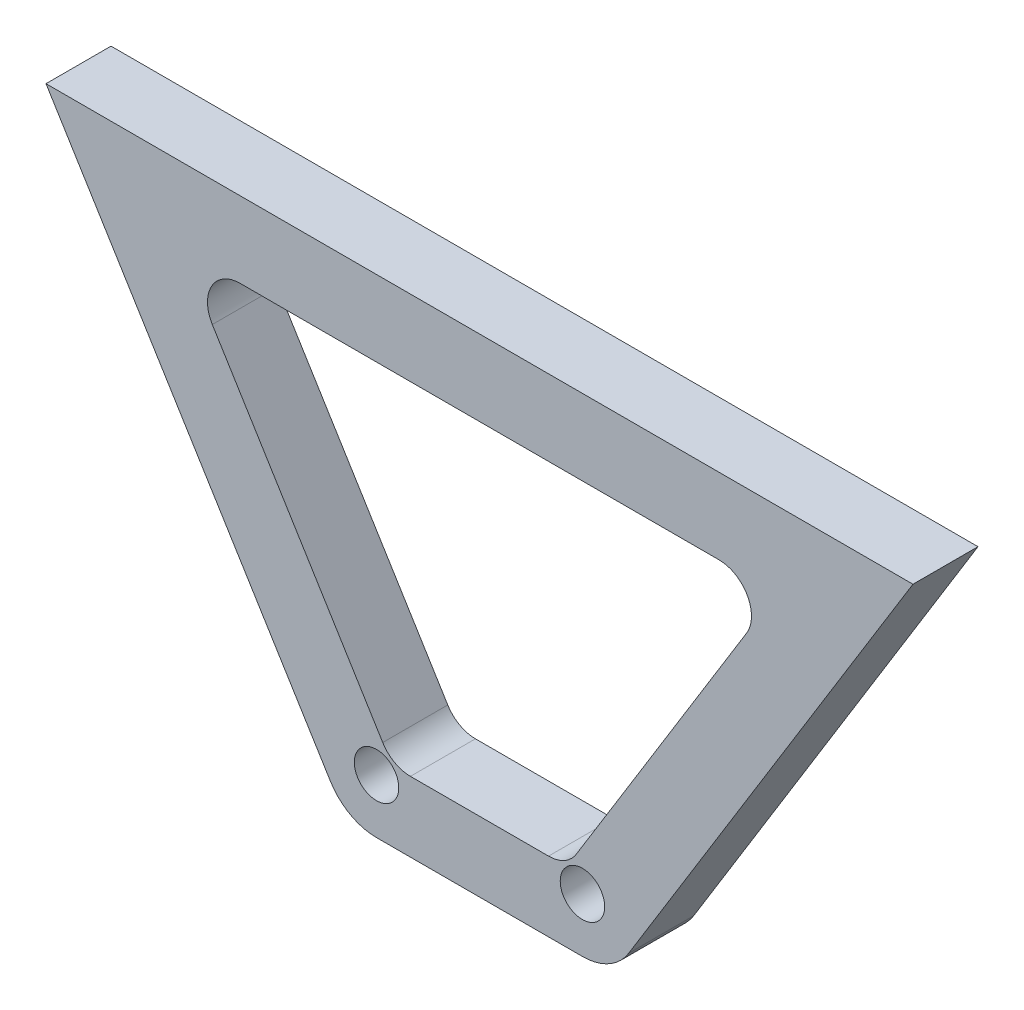
from build123d import *

# Parameters (mm, degrees)
SKETCH_1_R      = 2.05
EXTRUDE_1_DEPTH = 6


with BuildPart() as part:
    # Эскиз1 → Бобышка-Вытянуть1 (new body)
    with BuildSketch(Plane.XY):
        with BuildLine():
            Line((-40, 0), (40, 0))
            Line((40, 0), (13.757679871, -42.621480902))
            ThreePointArc((13.757679871, -42.621480902), (11.938503177, -44.365054668), (9.5, -45))
            Line((9.5, -45), (-9.5, -45))
            ThreePointArc((-9.5, -45), (-11.938503177, -44.365054668), (-13.757679871, -42.621480902))
            Line((-13.757679871, -42.621480902), (-40, 0))
        make_face()
        with Locations((-9.5, -40)):
            Circle(SKETCH_1_R, mode=Mode.SUBTRACT)
        with Locations((9.5, -40)):
            Circle(SKETCH_1_R, mode=Mode.SUBTRACT)
        with BuildLine():
            Line((-22.099450563, -7), (22.099450563, -7))
            ThreePointArc((22.099450563, -7), (24.718483364, -8.536898094), (24.654058486, -11.572888541))
            Line((24.654058486, -11.572888541), (8.928397586, -37.113730676))
            ThreePointArc((8.928397586, -37.113730676), (7.83689157, -38.159874936), (6.373789664, -38.540842135))
            Line((6.373789664, -38.540842135), (-6.373789664, -38.540842135))
            ThreePointArc((-6.373789664, -38.540842135), (-7.83689157, -38.159874936), (-8.928397586, -37.113730676))
            Line((-8.928397586, -37.113730676), (-24.654058486, -11.572888541))
            ThreePointArc((-24.654058486, -11.572888541), (-24.718483364, -8.536898094), (-22.099450563, -7))
        make_face(mode=Mode.SUBTRACT)
    extrude(amount=EXTRUDE_1_DEPTH)


solid = part.part
